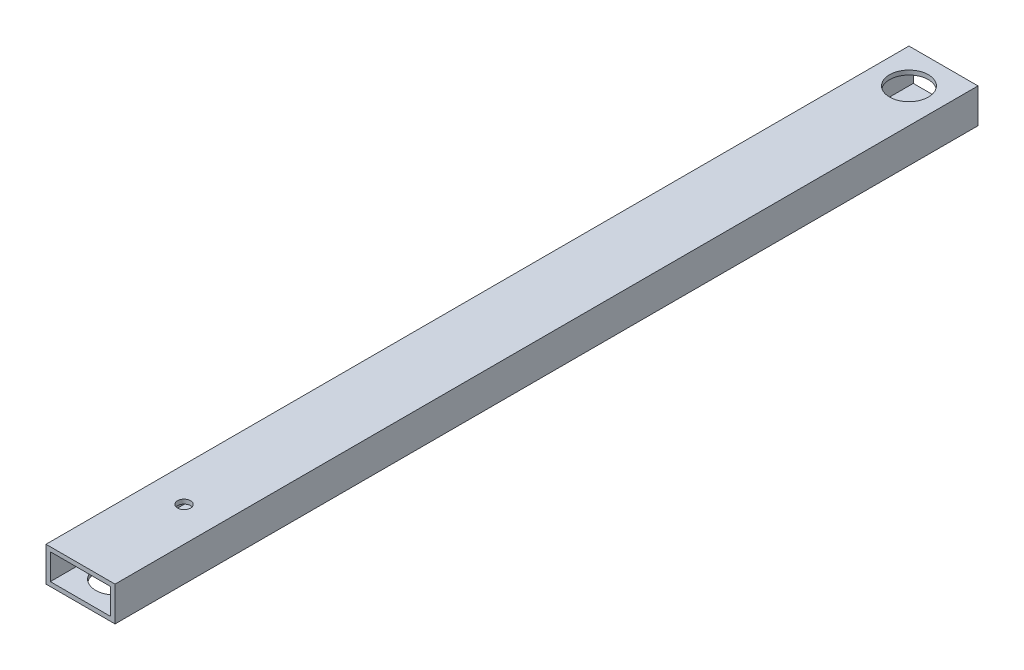
from build123d import *

# Parameters (mm, degrees)
SKETCH1_W           = 50.8
SKETCH1_H           = 25.4
BOSS_EXTRUDE1_DEPTH = 635
SKETCH2_W           = 44.45
SKETCH2_H           = 19.05
CUT_EXTRUDE1_DEPTH  = 635
SKETCH6_R           = 14.2875
CUT_EXTRUDE5_DEPTH  = 25.4
SKETCH7_R           = 14.2875
CUT_EXTRUDE6_DEPTH  = 3.175
SKETCH8_R           = 4.7625
CUT_EXTRUDE7_DEPTH  = 25.4


with BuildPart() as part:
    # Sketch1 → Boss-Extrude1 (new body)
    with BuildSketch(Plane.XY):
        with Locations((25.4, 12.7)):
            Rectangle(SKETCH1_W, SKETCH1_H)
    extrude(amount=BOSS_EXTRUDE1_DEPTH)

    # Sketch2 → Cut-Extrude1 (cut)
    with BuildSketch(Plane(origin=(0, 0, 0), x_dir=(-1, 0, 0), z_dir=(0, 0, -1))):
        with Locations((-25.4, 12.7)):
            Rectangle(SKETCH2_W, SKETCH2_H)
    extrude(amount=-CUT_EXTRUDE1_DEPTH, mode=Mode.SUBTRACT)

    # Sketch6 → Cut-Extrude5 (cut)
    with BuildSketch(Plane(origin=(0, 25.4, 0), x_dir=(1, 0, 0), z_dir=(0, 1, 0))):
        with Locations((25.4, -25.4)):
            Circle(SKETCH6_R)
    extrude(amount=-CUT_EXTRUDE5_DEPTH, mode=Mode.SUBTRACT)

    # Sketch7 → Cut-Extrude6 (cut)
    with BuildSketch(Plane.XZ):
        with Locations((25.4, 609.6)):
            Circle(SKETCH7_R)
    extrude(amount=-CUT_EXTRUDE6_DEPTH, mode=Mode.SUBTRACT)

    # Sketch8 → Cut-Extrude7 (cut)
    with BuildSketch(Plane(origin=(0, 25.4, 0), x_dir=(1, 0, 0), z_dir=(0, 1, 0))):
        with Locations((25.4, -558.8)):
            Circle(SKETCH8_R)
    extrude(amount=-CUT_EXTRUDE7_DEPTH, mode=Mode.SUBTRACT)


solid = part.part
